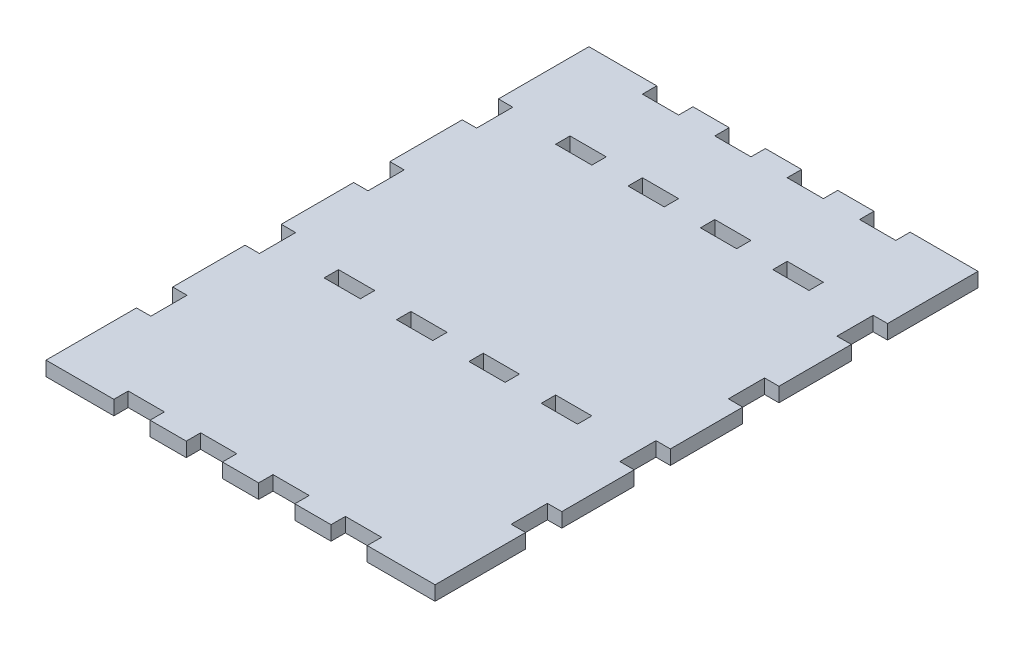
from build123d import *

# Parameters (mm, degrees)
SKETCH1_W           = 86
SKETCH1_H           = 120
BOSS_EXTRUDE1_DEPTH = 3.175
CUT_EXTRUDE1_REACH  = 149.669
SKETCH2_W           = 8
SKETCH2_H           = 3.175
SKETCH2_W_2         = 3.175
SKETCH2_H_2         = 8
CUT_EXTRUDE2_REACH  = 149.669
SKETCH3_W           = 8
SKETCH3_H           = 3.175
CUT_EXTRUDE3_REACH  = 149.669
SKETCH4_W           = 8
SKETCH4_H           = 3.175


with BuildPart() as part:
    # Sketch1 → Boss-Extrude1 (new body)
    with BuildSketch(Plane(origin=(0, 0, 0), x_dir=(1, 0, 0), z_dir=(0, 1, 0))):
        with Locations((43, -60)):
            Rectangle(SKETCH1_W, SKETCH1_H)
    extrude(amount=BOSS_EXTRUDE1_DEPTH)

    # Sketch2 → Cut-Extrude1 (cut, up to next)
    with BuildSketch(Plane(origin=(0, 3.175, 0), x_dir=(1, 0, 0), z_dir=(0, 1, 0)), mode=Mode.PRIVATE) as cut_extrude1_sk1:
        with Locations((67, -1.5875)):
            Rectangle(SKETCH2_W, SKETCH2_H)
    cut_extrude1_tool1 = extrude(cut_extrude1_sk1.sketch, amount=-CUT_EXTRUDE1_REACH, mode=Mode.PRIVATE) & part.part
    # Sketch2 → Cut-Extrude1 (cut, up to next)
    with BuildSketch(Plane(origin=(0, 3.175, 0), x_dir=(1, 0, 0), z_dir=(0, 1, 0)), mode=Mode.PRIVATE) as cut_extrude1_sk2:
        with Locations((51, -1.5875)):
            Rectangle(SKETCH2_W, SKETCH2_H)
    cut_extrude1_tool2 = extrude(cut_extrude1_sk2.sketch, amount=-CUT_EXTRUDE1_REACH, mode=Mode.PRIVATE) & part.part
    # Sketch2 → Cut-Extrude1 (cut, up to next)
    with BuildSketch(Plane(origin=(0, 3.175, 0), x_dir=(1, 0, 0), z_dir=(0, 1, 0)), mode=Mode.PRIVATE) as cut_extrude1_sk3:
        with Locations((19, -1.5875)):
            Rectangle(SKETCH2_W, SKETCH2_H)
    cut_extrude1_tool3 = extrude(cut_extrude1_sk3.sketch, amount=-CUT_EXTRUDE1_REACH, mode=Mode.PRIVATE) & part.part
    # Sketch2 → Cut-Extrude1 (cut, up to next)
    with BuildSketch(Plane(origin=(0, 3.175, 0), x_dir=(1, 0, 0), z_dir=(0, 1, 0)), mode=Mode.PRIVATE) as cut_extrude1_sk4:
        with Locations((35, -1.5875)):
            Rectangle(SKETCH2_W, SKETCH2_H)
    cut_extrude1_tool4 = extrude(cut_extrude1_sk4.sketch, amount=-CUT_EXTRUDE1_REACH, mode=Mode.PRIVATE) & part.part
    # Sketch2 → Cut-Extrude1 (cut, up to next)
    with BuildSketch(Plane(origin=(0, 3.175, 0), x_dir=(1, 0, 0), z_dir=(0, 1, 0)), mode=Mode.PRIVATE) as cut_extrude1_sk5:
        with Locations((1.5875, -24)):
            Rectangle(SKETCH2_W_2, SKETCH2_H_2)
    cut_extrude1_tool5 = extrude(cut_extrude1_sk5.sketch, amount=-CUT_EXTRUDE1_REACH, mode=Mode.PRIVATE) & part.part
    # Sketch2 → Cut-Extrude1 (cut, up to next)
    with BuildSketch(Plane(origin=(0, 3.175, 0), x_dir=(1, 0, 0), z_dir=(0, 1, 0)), mode=Mode.PRIVATE) as cut_extrude1_sk6:
        with Locations((1.5875, -48)):
            Rectangle(SKETCH2_W_2, SKETCH2_H_2)
    cut_extrude1_tool6 = extrude(cut_extrude1_sk6.sketch, amount=-CUT_EXTRUDE1_REACH, mode=Mode.PRIVATE) & part.part
    # Sketch2 → Cut-Extrude1 (cut, up to next)
    with BuildSketch(Plane(origin=(0, 3.175, 0), x_dir=(1, 0, 0), z_dir=(0, 1, 0)), mode=Mode.PRIVATE) as cut_extrude1_sk7:
        with Locations((1.5875, -96)):
            Rectangle(SKETCH2_W_2, SKETCH2_H_2)
    cut_extrude1_tool7 = extrude(cut_extrude1_sk7.sketch, amount=-CUT_EXTRUDE1_REACH, mode=Mode.PRIVATE) & part.part
    # Sketch2 → Cut-Extrude1 (cut, up to next)
    with BuildSketch(Plane(origin=(0, 3.175, 0), x_dir=(1, 0, 0), z_dir=(0, 1, 0)), mode=Mode.PRIVATE) as cut_extrude1_sk8:
        with Locations((1.5875, -72)):
            Rectangle(SKETCH2_W_2, SKETCH2_H_2)
    cut_extrude1_tool8 = extrude(cut_extrude1_sk8.sketch, amount=-CUT_EXTRUDE1_REACH, mode=Mode.PRIVATE) & part.part
    # Sketch2 → Cut-Extrude1 (cut, up to next)
    with BuildSketch(Plane(origin=(0, 3.175, 0), x_dir=(1, 0, 0), z_dir=(0, 1, 0)), mode=Mode.PRIVATE) as cut_extrude1_sk9:
        with Locations((19, -118.4125)):
            Rectangle(SKETCH2_W, SKETCH2_H)
    cut_extrude1_tool9 = extrude(cut_extrude1_sk9.sketch, amount=-CUT_EXTRUDE1_REACH, mode=Mode.PRIVATE) & part.part
    # Sketch2 → Cut-Extrude1 (cut, up to next)
    with BuildSketch(Plane(origin=(0, 3.175, 0), x_dir=(1, 0, 0), z_dir=(0, 1, 0)), mode=Mode.PRIVATE) as cut_extrude1_sk10:
        with Locations((35, -118.4125)):
            Rectangle(SKETCH2_W, SKETCH2_H)
    cut_extrude1_tool10 = extrude(cut_extrude1_sk10.sketch, amount=-CUT_EXTRUDE1_REACH, mode=Mode.PRIVATE) & part.part
    # Sketch2 → Cut-Extrude1 (cut, up to next)
    with BuildSketch(Plane(origin=(0, 3.175, 0), x_dir=(1, 0, 0), z_dir=(0, 1, 0)), mode=Mode.PRIVATE) as cut_extrude1_sk11:
        with Locations((67, -118.4125)):
            Rectangle(SKETCH2_W, SKETCH2_H)
    cut_extrude1_tool11 = extrude(cut_extrude1_sk11.sketch, amount=-CUT_EXTRUDE1_REACH, mode=Mode.PRIVATE) & part.part
    # Sketch2 → Cut-Extrude1 (cut, up to next)
    with BuildSketch(Plane(origin=(0, 3.175, 0), x_dir=(1, 0, 0), z_dir=(0, 1, 0)), mode=Mode.PRIVATE) as cut_extrude1_sk12:
        with Locations((51, -118.4125)):
            Rectangle(SKETCH2_W, SKETCH2_H)
    cut_extrude1_tool12 = extrude(cut_extrude1_sk12.sketch, amount=-CUT_EXTRUDE1_REACH, mode=Mode.PRIVATE) & part.part
    # Sketch2 → Cut-Extrude1 (cut, up to next)
    with BuildSketch(Plane(origin=(0, 3.175, 0), x_dir=(1, 0, 0), z_dir=(0, 1, 0)), mode=Mode.PRIVATE) as cut_extrude1_sk13:
        with Locations((84.4125, -96)):
            Rectangle(SKETCH2_W_2, SKETCH2_H_2)
    cut_extrude1_tool13 = extrude(cut_extrude1_sk13.sketch, amount=-CUT_EXTRUDE1_REACH, mode=Mode.PRIVATE) & part.part
    # Sketch2 → Cut-Extrude1 (cut, up to next)
    with BuildSketch(Plane(origin=(0, 3.175, 0), x_dir=(1, 0, 0), z_dir=(0, 1, 0)), mode=Mode.PRIVATE) as cut_extrude1_sk14:
        with Locations((84.4125, -72)):
            Rectangle(SKETCH2_W_2, SKETCH2_H_2)
    cut_extrude1_tool14 = extrude(cut_extrude1_sk14.sketch, amount=-CUT_EXTRUDE1_REACH, mode=Mode.PRIVATE) & part.part
    # Sketch2 → Cut-Extrude1 (cut, up to next)
    with BuildSketch(Plane(origin=(0, 3.175, 0), x_dir=(1, 0, 0), z_dir=(0, 1, 0)), mode=Mode.PRIVATE) as cut_extrude1_sk15:
        with Locations((84.4125, -24)):
            Rectangle(SKETCH2_W_2, SKETCH2_H_2)
    cut_extrude1_tool15 = extrude(cut_extrude1_sk15.sketch, amount=-CUT_EXTRUDE1_REACH, mode=Mode.PRIVATE) & part.part
    # Sketch2 → Cut-Extrude1 (cut, up to next)
    with BuildSketch(Plane(origin=(0, 3.175, 0), x_dir=(1, 0, 0), z_dir=(0, 1, 0)), mode=Mode.PRIVATE) as cut_extrude1_sk16:
        with Locations((84.4125, -48)):
            Rectangle(SKETCH2_W_2, SKETCH2_H_2)
    cut_extrude1_tool16 = extrude(cut_extrude1_sk16.sketch, amount=-CUT_EXTRUDE1_REACH, mode=Mode.PRIVATE) & part.part
    add(cut_extrude1_tool1.solids().sort_by_distance((67, 3.175, 1.5875))[0], mode=Mode.SUBTRACT)
    add(cut_extrude1_tool2.solids().sort_by_distance((51, 3.175, 1.5875))[0], mode=Mode.SUBTRACT)
    add(cut_extrude1_tool3.solids().sort_by_distance((19, 3.175, 1.5875))[0], mode=Mode.SUBTRACT)
    add(cut_extrude1_tool4.solids().sort_by_distance((35, 3.175, 1.5875))[0], mode=Mode.SUBTRACT)
    add(cut_extrude1_tool5.solids().sort_by_distance((1.5875, 3.175, 24))[0], mode=Mode.SUBTRACT)
    add(cut_extrude1_tool6.solids().sort_by_distance((1.5875, 3.175, 48))[0], mode=Mode.SUBTRACT)
    add(cut_extrude1_tool7.solids().sort_by_distance((1.5875, 3.175, 96))[0], mode=Mode.SUBTRACT)
    add(cut_extrude1_tool8.solids().sort_by_distance((1.5875, 3.175, 72))[0], mode=Mode.SUBTRACT)
    add(cut_extrude1_tool9.solids().sort_by_distance((19, 3.175, 118.4125))[0], mode=Mode.SUBTRACT)
    add(cut_extrude1_tool10.solids().sort_by_distance((35, 3.175, 118.4125))[0], mode=Mode.SUBTRACT)
    add(cut_extrude1_tool11.solids().sort_by_distance((67, 3.175, 118.4125))[0], mode=Mode.SUBTRACT)
    add(cut_extrude1_tool12.solids().sort_by_distance((51, 3.175, 118.4125))[0], mode=Mode.SUBTRACT)
    add(cut_extrude1_tool13.solids().sort_by_distance((84.4125, 3.175, 96))[0], mode=Mode.SUBTRACT)
    add(cut_extrude1_tool14.solids().sort_by_distance((84.4125, 3.175, 72))[0], mode=Mode.SUBTRACT)
    add(cut_extrude1_tool15.solids().sort_by_distance((84.4125, 3.175, 24))[0], mode=Mode.SUBTRACT)
    add(cut_extrude1_tool16.solids().sort_by_distance((84.4125, 3.175, 48))[0], mode=Mode.SUBTRACT)

    # Sketch3 → Cut-Extrude2 (cut, up to next)
    with BuildSketch(Plane(origin=(0, 3.175, 0), x_dir=(1, 0, 0), z_dir=(0, 1, 0)), mode=Mode.PRIVATE) as cut_extrude2_sk1:
        with Locations((67, -20.7625)):
            Rectangle(SKETCH3_W, SKETCH3_H)
    cut_extrude2_tool1 = extrude(cut_extrude2_sk1.sketch, amount=-CUT_EXTRUDE2_REACH, mode=Mode.PRIVATE) & part.part
    # Sketch3 → Cut-Extrude2 (cut, up to next)
    with BuildSketch(Plane(origin=(0, 3.175, 0), x_dir=(1, 0, 0), z_dir=(0, 1, 0)), mode=Mode.PRIVATE) as cut_extrude2_sk2:
        with Locations((51, -20.7625)):
            Rectangle(SKETCH3_W, SKETCH3_H)
    cut_extrude2_tool2 = extrude(cut_extrude2_sk2.sketch, amount=-CUT_EXTRUDE2_REACH, mode=Mode.PRIVATE) & part.part
    # Sketch3 → Cut-Extrude2 (cut, up to next)
    with BuildSketch(Plane(origin=(0, 3.175, 0), x_dir=(1, 0, 0), z_dir=(0, 1, 0)), mode=Mode.PRIVATE) as cut_extrude2_sk3:
        with Locations((19, -20.7625)):
            Rectangle(SKETCH3_W, SKETCH3_H)
    cut_extrude2_tool3 = extrude(cut_extrude2_sk3.sketch, amount=-CUT_EXTRUDE2_REACH, mode=Mode.PRIVATE) & part.part
    # Sketch3 → Cut-Extrude2 (cut, up to next)
    with BuildSketch(Plane(origin=(0, 3.175, 0), x_dir=(1, 0, 0), z_dir=(0, 1, 0)), mode=Mode.PRIVATE) as cut_extrude2_sk4:
        with Locations((35, -20.7625)):
            Rectangle(SKETCH3_W, SKETCH3_H)
    cut_extrude2_tool4 = extrude(cut_extrude2_sk4.sketch, amount=-CUT_EXTRUDE2_REACH, mode=Mode.PRIVATE) & part.part
    add(cut_extrude2_tool1.solids().sort_by_distance((67, 3.175, 20.7625))[0], mode=Mode.SUBTRACT)
    add(cut_extrude2_tool2.solids().sort_by_distance((51, 3.175, 20.7625))[0], mode=Mode.SUBTRACT)
    add(cut_extrude2_tool3.solids().sort_by_distance((19, 3.175, 20.7625))[0], mode=Mode.SUBTRACT)
    add(cut_extrude2_tool4.solids().sort_by_distance((35, 3.175, 20.7625))[0], mode=Mode.SUBTRACT)

    # Sketch4 → Cut-Extrude3 (cut, up to next)
    with BuildSketch(Plane(origin=(0, 3.175, 0), x_dir=(1, 0, 0), z_dir=(0, 1, 0)), mode=Mode.PRIVATE) as cut_extrude3_sk1:
        with Locations((67, -71.9375)):
            Rectangle(SKETCH4_W, SKETCH4_H)
    cut_extrude3_tool1 = extrude(cut_extrude3_sk1.sketch, amount=-CUT_EXTRUDE3_REACH, mode=Mode.PRIVATE) & part.part
    # Sketch4 → Cut-Extrude3 (cut, up to next)
    with BuildSketch(Plane(origin=(0, 3.175, 0), x_dir=(1, 0, 0), z_dir=(0, 1, 0)), mode=Mode.PRIVATE) as cut_extrude3_sk2:
        with Locations((51, -71.9375)):
            Rectangle(SKETCH4_W, SKETCH4_H)
    cut_extrude3_tool2 = extrude(cut_extrude3_sk2.sketch, amount=-CUT_EXTRUDE3_REACH, mode=Mode.PRIVATE) & part.part
    # Sketch4 → Cut-Extrude3 (cut, up to next)
    with BuildSketch(Plane(origin=(0, 3.175, 0), x_dir=(1, 0, 0), z_dir=(0, 1, 0)), mode=Mode.PRIVATE) as cut_extrude3_sk3:
        with Locations((19, -71.9375)):
            Rectangle(SKETCH4_W, SKETCH4_H)
    cut_extrude3_tool3 = extrude(cut_extrude3_sk3.sketch, amount=-CUT_EXTRUDE3_REACH, mode=Mode.PRIVATE) & part.part
    # Sketch4 → Cut-Extrude3 (cut, up to next)
    with BuildSketch(Plane(origin=(0, 3.175, 0), x_dir=(1, 0, 0), z_dir=(0, 1, 0)), mode=Mode.PRIVATE) as cut_extrude3_sk4:
        with Locations((35, -71.9375)):
            Rectangle(SKETCH4_W, SKETCH4_H)
    cut_extrude3_tool4 = extrude(cut_extrude3_sk4.sketch, amount=-CUT_EXTRUDE3_REACH, mode=Mode.PRIVATE) & part.part
    add(cut_extrude3_tool1.solids().sort_by_distance((67, 3.175, 71.9375))[0], mode=Mode.SUBTRACT)
    add(cut_extrude3_tool2.solids().sort_by_distance((51, 3.175, 71.9375))[0], mode=Mode.SUBTRACT)
    add(cut_extrude3_tool3.solids().sort_by_distance((19, 3.175, 71.9375))[0], mode=Mode.SUBTRACT)
    add(cut_extrude3_tool4.solids().sort_by_distance((35, 3.175, 71.9375))[0], mode=Mode.SUBTRACT)


solid = part.part
